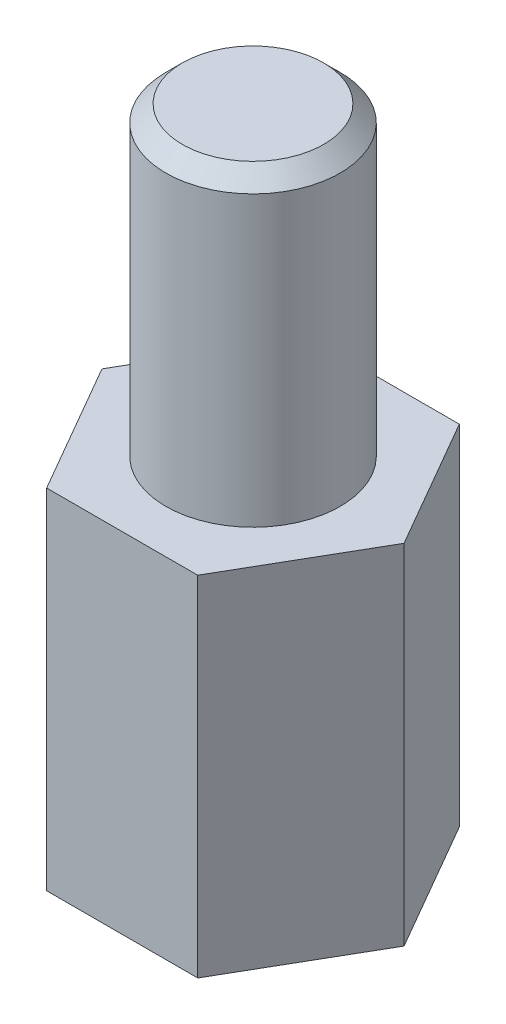
from build123d import *

# Parameters (mm, degrees)
EXTRUDE_1_DEPTH              = 8
HOLE_WIZARD_M4_1_D           = 3.3
HOLE_WIZARD_M4_1_DEPTH       = 5
HOLE_WIZARD_M4_1_CSINK_D     = 4.05
HOLE_WIZARD_M4_1_CSINK_ANGLE = 90
HOLE_WIZARD_M4_1_TIP         = 0.991420021
MOVE_BODY_1_ANGLE            = 90


# Read off the part's stored shape, not the designer's step: M4 机械螺纹 螺柱1
with BuildPart() as part:
    # 草图1 → 凸台-拉伸1 (new body)
    with BuildSketch(Plane.XY):
        Polygon((3.464101615, 0), (1.732050808, 3), (-1.732050808, 3), (-3.464101615, 0), (-1.732050808, -3), (1.732050808, -3), align=None)
    extrude(amount=EXTRUDE_1_DEPTH)

    # M4 螺纹孔1
    with Locations(Plane(origin=(0, 0, 0), x_dir=(-1, 0, 0), z_dir=(0, 0, -1))):
        with Locations((0, 0)):
            CounterSinkHole(HOLE_WIZARD_M4_1_D / 2, HOLE_WIZARD_M4_1_CSINK_D / 2, depth=HOLE_WIZARD_M4_1_DEPTH, counter_sink_angle=HOLE_WIZARD_M4_1_CSINK_ANGLE)
            with Locations((0, 0, -(HOLE_WIZARD_M4_1_DEPTH + HOLE_WIZARD_M4_1_TIP / 2))):  # 118° drill point
                Cone(0, HOLE_WIZARD_M4_1_D / 2, HOLE_WIZARD_M4_1_TIP, mode=Mode.SUBTRACT)

    # M4 机械螺纹 螺柱1 outline → M4 机械螺纹 螺柱1 (revolve)
    with BuildSketch(Plane.XZ):
        Polygon((1.621, 15), (0, 15), (0, 8), (2, 8), (2, 14.621), align=None)
    revolve(axis=Axis((0, 0, 0), (0, 0, 1)))


with BuildPart() as part_1:
    # Move Body 1: moved
    add(part.part.rotate(Axis((0, 0, 6), (-1, 0, 0)), MOVE_BODY_1_ANGLE))


solid = part_1.part
